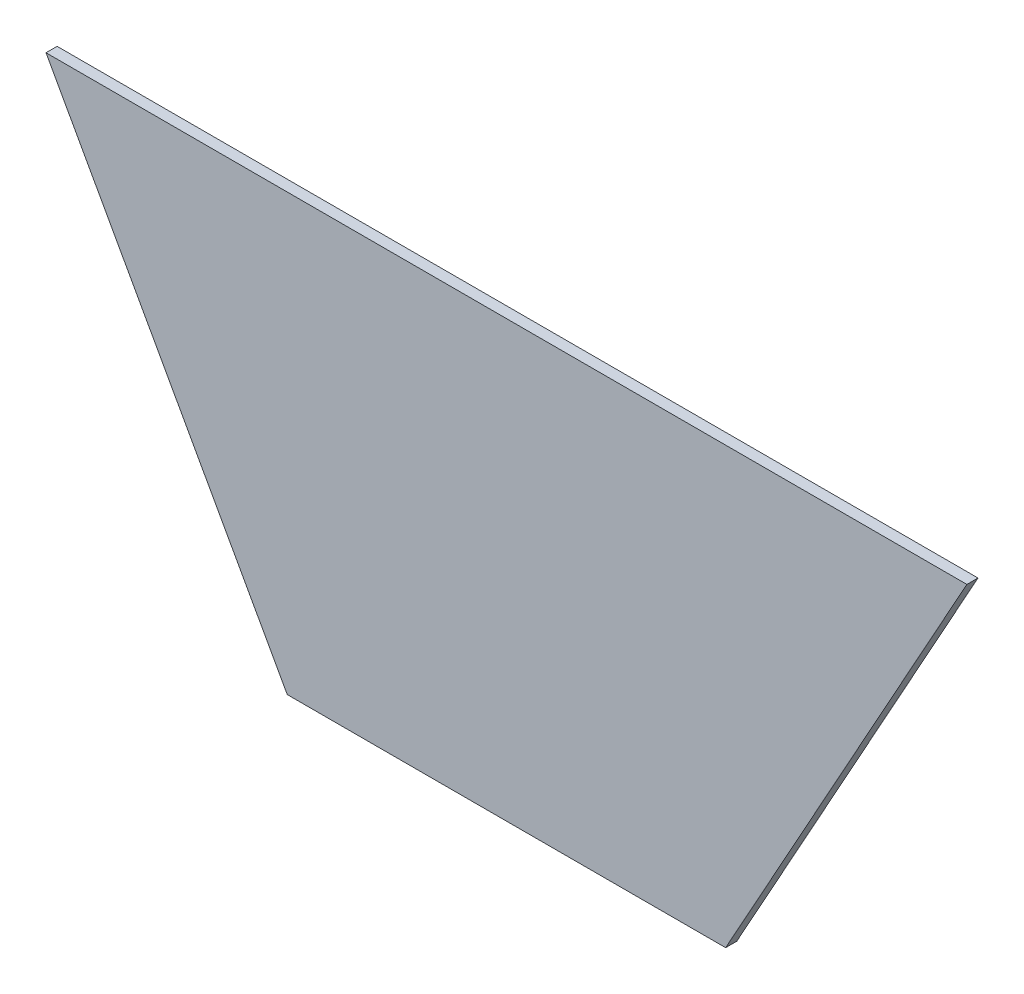
from build123d import *

# Parameters (mm, degrees)
BOSS_EXTRUDE1_DEPTH = 11.90625


with BuildPart() as part:
    # Sketch1 → Boss-Extrude1 (new body)
    with BuildSketch(Plane.XY):
        Polygon((-73.014043491, 13.487156082), (396.885956509, 13.487156082), (655.483407948, 480.00930787), (-331.611494931, 480.00930787), align=None)
    extrude(amount=BOSS_EXTRUDE1_DEPTH)


solid = part.part
